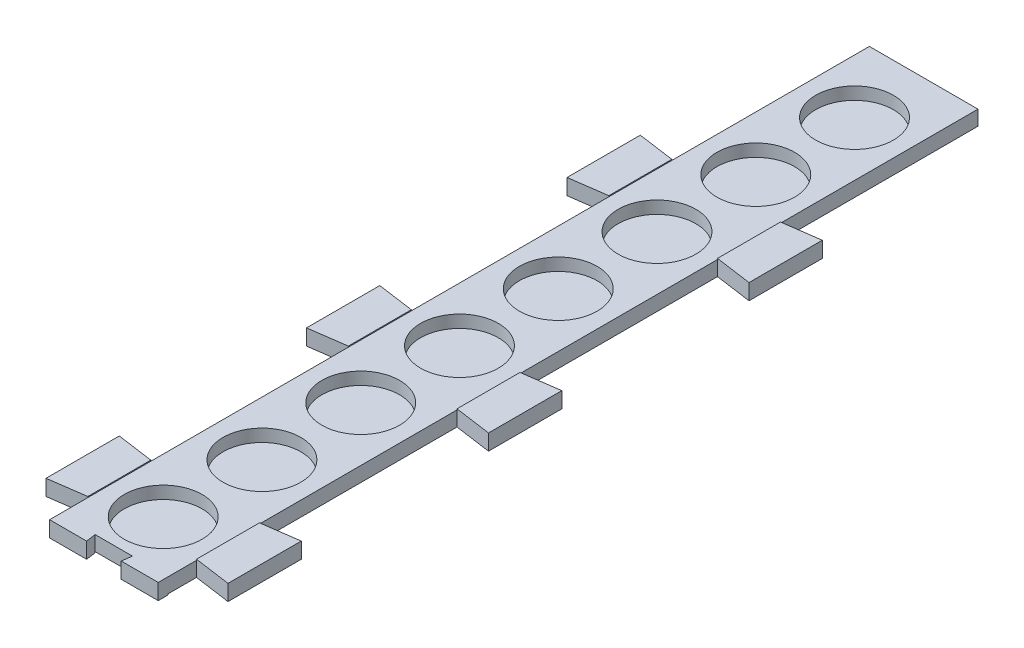
from build123d import *

# Parameters (mm, degrees)
SKETCH1_W           = 27.94
SKETCH1_H           = 391.16
BOSS_EXTRUDE1_DEPTH = 3.81
SKETCH2_R           = 10
CUT_EXTRUDE1_DEPTH  = 3.21
BOSS_EXTRUDE2_DEPTH = 4.064
SKETCH5_W           = 46.80460671
SKETCH5_H           = 4.064
CUT_EXTRUDE2_DEPTH  = 182.88
BOSS_EXTRUDE3_DEPTH = 4.064


with BuildPart() as part:
    # Sketch1 → Boss-Extrude1 (new body)
    with BuildSketch(Plane(origin=(0, 0, 0), x_dir=(1, 0, 0), z_dir=(0, 1, 0))):
        Rectangle(SKETCH1_W, SKETCH1_H)
    extrude(amount=BOSS_EXTRUDE1_DEPTH)

    # Sketch2 → Cut-Extrude1 (cut)
    with BuildSketch(Plane(origin=(0, 3.81, 0), x_dir=(1, 0, 0), z_dir=(0, 1, 0))):
        with Locations((0, 177.8)):
            Circle(SKETCH2_R)
        with Locations((0, 152.4)):
            Circle(SKETCH2_R)
        with Locations((0, 127)):
            Circle(SKETCH2_R)
        with Locations((0, 101.6)):
            Circle(SKETCH2_R)
        with Locations((0, 76.2)):
            Circle(SKETCH2_R)
        with Locations((0, 50.8)):
            Circle(SKETCH2_R)
        with Locations((0, 25.4)):
            Circle(SKETCH2_R)
        Circle(SKETCH2_R)
        with Locations((0, -25.4)):
            Circle(SKETCH2_R)
        with Locations((0, -50.8)):
            Circle(SKETCH2_R)
        with Locations((0, -76.2)):
            Circle(SKETCH2_R)
        with Locations((0, -101.6)):
            Circle(SKETCH2_R)
        with Locations((0, -127)):
            Circle(SKETCH2_R)
        with Locations((0, -152.4)):
            Circle(SKETCH2_R)
        with Locations((0, -177.8)):
            Circle(SKETCH2_R)
    extrude(amount=-CUT_EXTRUDE1_DEPTH, mode=Mode.SUBTRACT)

    # Sketch4 → Boss-Extrude2 (add)
    with BuildSketch(Plane(origin=(0, 0, 0), x_dir=(1, 0, 0), z_dir=(0, 1, 0))):
        Polygon((23.402303355, -54.881033493), (13.97, -56.20665728), (13.97, -72.402209707), (23.402303355, -73.727833493), align=None)
        Polygon((23.402303355, 146.105623787), (13.97, 144.78), (13.97, 128.584447573), (23.402303355, 127.258823787), align=None)
        Polygon((-13.97, 128.584447573), (-13.97, 144.78), (-23.402303355, 146.105623787), (-23.402303355, 127.258823787), align=None)
        Polygon((23.402303355, 79.11007136), (13.97, 77.784447573), (13.97, 61.588895147), (23.402303355, 60.26327136), align=None)
        Polygon((23.402303355, 12.114518933), (13.97, 10.788895147), (13.97, -5.40665728), (23.402303355, -6.732281067), align=None)
        Polygon((-13.97, -5.40665728), (-13.97, 10.788895147), (-23.402303355, 12.114518933), (-23.402303355, -6.732281067), align=None)
        Polygon((-13.97, 61.588895147), (-13.97, 77.784447573), (-23.402303355, 79.11007136), (-23.402303355, 60.26327136), align=None)
        Polygon((23.402303355, -121.87658592), (13.97, -123.202209707), (13.97, -139.397762134), (23.402303355, -140.72338592), align=None)
        Polygon((-13.97, -139.397762134), (-13.97, -123.202209707), (-23.402303355, -121.87658592), (-23.402303355, -140.72338592), align=None)
        Polygon((-13.97, -72.402209707), (-13.97, -56.20665728), (-23.402303355, -54.881033493), (-23.402303355, -73.727833493), align=None)
    extrude(amount=BOSS_EXTRUDE2_DEPTH)

    # Sketch5 → Cut-Extrude2 (cut)
    with BuildSketch(Plane.XY.offset(195.58)):
        with Locations((0, 2.032)):
            Rectangle(SKETCH5_W, SKETCH5_H)
    extrude(amount=-CUT_EXTRUDE2_DEPTH, mode=Mode.SUBTRACT)

    # Sketch6 → Boss-Extrude3 (add)
    with BuildSketch(Plane(origin=(0, 3.81, 0), x_dir=(1, 0, 0), z_dir=(0, 1, 0))):
        Polygon((-4.80197372, -12.7), (-4.445, -15.24), (-13.97, -15.24), (-13.97, -12.7), align=None)
        Polygon((13.97, -12.7), (13.97, -15.24), (4.445, -15.24), (4.80197372, -12.7), align=None)
    extrude(amount=-BOSS_EXTRUDE3_DEPTH)


solid = part.part
